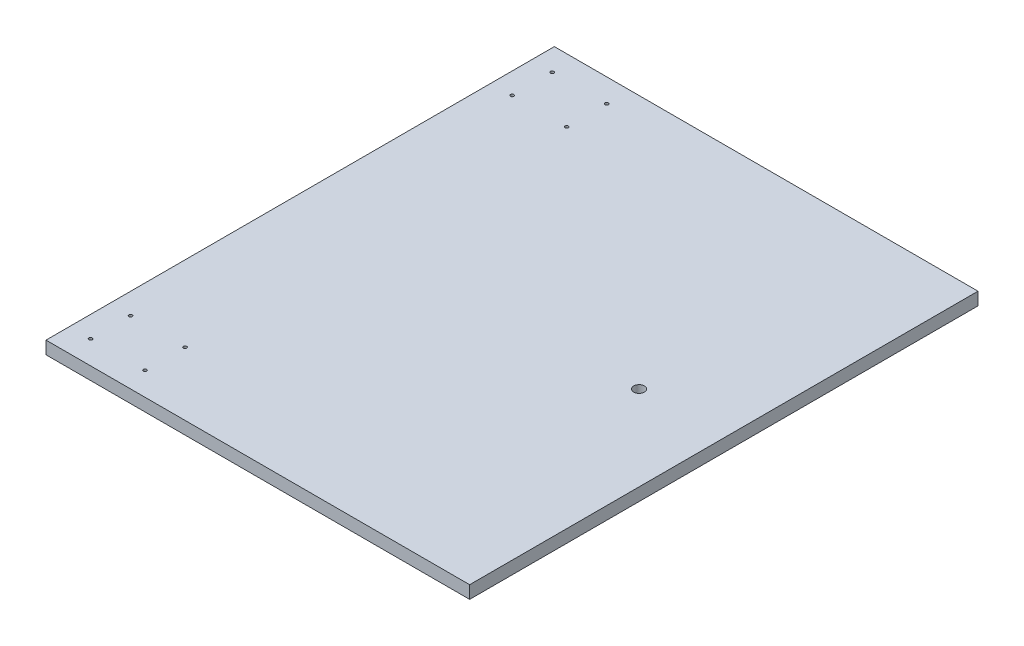
from build123d import *

# Parameters (mm, degrees)
SKETCH1_W           = 381
SKETCH1_H           = 457.2
BOSS_EXTRUDE1_DEPTH = 11.4554
SKETCH3_R           = 4.826
SKETCH3_R_2         = 1.5
CUT_EXTRUDE1_DEPTH  = 298.790926976


with BuildPart() as part:
    # Sketch1 → Boss-Extrude1 (new body)
    with BuildSketch(Plane(origin=(0, 0, 0), x_dir=(1, 0, 0), z_dir=(0, 1, 0))):
        Rectangle(SKETCH1_W, SKETCH1_H)
    extrude(amount=BOSS_EXTRUDE1_DEPTH)

    # Sketch3 → Cut-Extrude1 (cut, through all)
    with BuildSketch(Plane(origin=(0, 11.4554, 0), x_dir=(1, 0, 0), z_dir=(0, 1, 0))):
        with Locations((114.3, 0)):
            Circle(SKETCH3_R)
        with Locations((-122.45, 207.6)):
            Circle(SKETCH3_R_2)
        with Locations((-171.45, 207.6)):
            Circle(SKETCH3_R_2)
        with Locations((-171.45, 171.6)):
            Circle(SKETCH3_R_2)
        with Locations((-122.45, 171.6)):
            Circle(SKETCH3_R_2)
        with Locations((-122.45, -171.6)):
            Circle(SKETCH3_R_2)
        with Locations((-171.45, -171.6)):
            Circle(SKETCH3_R_2)
        with Locations((-171.45, -207.6)):
            Circle(SKETCH3_R_2)
        with Locations((-122.45, -207.6)):
            Circle(SKETCH3_R_2)
    extrude(amount=-CUT_EXTRUDE1_DEPTH, mode=Mode.SUBTRACT)


solid = part.part
